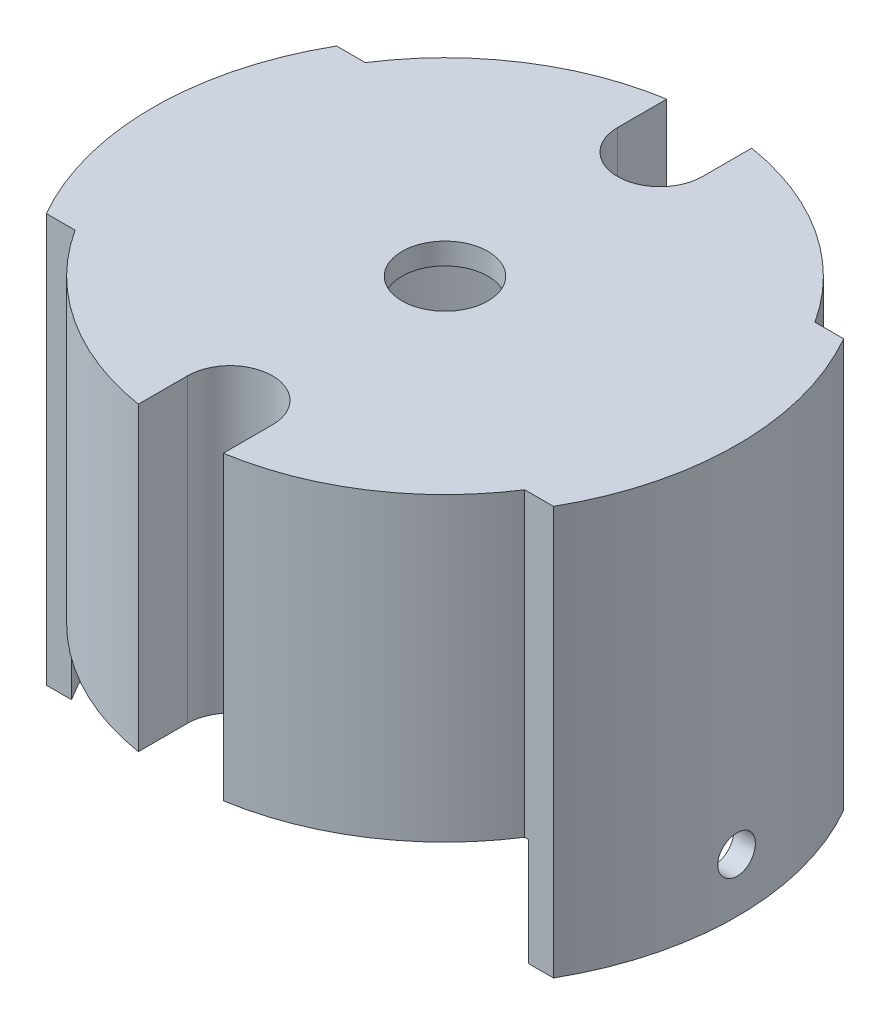
from build123d import *

# Parameters (mm, degrees)
SKETCH2_R               = 27.178
BOSS_EXTRUDE1_DEPTH     = 10
BOSS_EXTRUDE2_START     = -28
BOSS_EXTRUDE2_DEPTH     = 28
SHELL1_START            = -10
SHELL1_DEPTH            = 36
SHELL1_2_DEPTH          = 8
CUT_EXTRUDE3_DEPTH      = 10
CUT_EXTRUDE4_DEPTH      = 47.115916344
CUT_EXTRUDE4_DEPTH_BACK = 47.115916344
SKETCH6_R               = 1.75
SKETCH7_R               = 4
CUT_EXTRUDE6_DEPTH      = 47.115916478


# Read off the part's stored shape, not the designer's step: Shell1
with BuildPart() as part:
    # Sketch2 → Boss-Extrude1 (new body)
    with BuildSketch(Plane(origin=(0, 0, 0), x_dir=(1, 0, 0), z_dir=(0, 1, 0))):
        with Locations(Location((0, 0, 0), (0, 0, 270))):
            Circle(SKETCH2_R)
    extrude(amount=-BOSS_EXTRUDE1_DEPTH)

    # Sketch3 → Boss-Extrude2 (add)
    with BuildSketch(Plane(origin=(0, 0, 0), x_dir=(-1, 0, 0), z_dir=(0, -1, 0)).offset(BOSS_EXTRUDE2_START)):
        with BuildLine():
            Line((-23.587998728, 13.5), (-20.913788663, 13.5))
            ThreePointArc((-20.913788663, 13.5), (-13.609833087, 20.842480649), (-3.95, 24.57710431))
            Line((-3.95, 24.57710431), (-3.95, 20))
            ThreePointArc((-3.95, 20), (0, 16.05), (3.95, 20))
            Line((3.95, 20), (3.95, 24.57710431))
            ThreePointArc((3.95, 24.57710431), (13.609833087, 20.842480649), (20.913788663, 13.5))
            Line((20.913788663, 13.5), (23.587998728, 13.5))
            ThreePointArc((23.587998728, 13.5), (27.178, 0), (23.587998728, -13.5))
            Line((23.587998728, -13.5), (20.913788663, -13.5))
            ThreePointArc((20.913788663, -13.5), (13.609833087, -20.842480649), (3.95, -24.57710431))
            Line((3.95, -24.57710431), (3.95, -20))
            ThreePointArc((3.95, -20), (0, -16.05), (-3.95, -20))
            Line((-3.95, -20), (-3.95, -24.57710431))
            ThreePointArc((-3.95, -24.57710431), (-13.609833087, -20.842480649), (-20.913788663, -13.5))
            Line((-20.913788663, -13.5), (-23.587998728, -13.5))
            ThreePointArc((-23.587998728, -13.5), (-27.178, 0), (-23.587998728, 13.5))
        make_face()
    extrude(amount=BOSS_EXTRUDE2_DEPTH)

    # Shell1 outline → Shell1 (cut)
    with BuildSketch(Plane(origin=(0, 0, 0), x_dir=(1, 0, 0), z_dir=(0, 1, 0)).offset(SHELL1_START)):
        with BuildLine():
            ThreePointArc((22.398251807, -11.5), (25.178, 0), (22.398251807, 11.5))
            Line((22.398251807, 11.5), (19.794356677, 11.5))
            ThreePointArc((19.794356677, 11.5), (13.921689669, 18.172867496), (5.95, 22.105747132))
            Line((5.95, 22.105747132), (5.95, 20))
            ThreePointArc((5.95, 20), (0, 14.05), (-5.95, 20))
            Line((-5.95, 20), (-5.95, 22.105747132))
            ThreePointArc((-5.95, 22.105747132), (-13.921689669, 18.172867496), (-19.794356677, 11.5))
            Line((-19.794356677, 11.5), (-22.398251807, 11.5))
            ThreePointArc((-22.398251807, 11.5), (-25.178, 0), (-22.398251807, -11.5))
            Line((-22.398251807, -11.5), (-19.794356677, -11.5))
            ThreePointArc((-19.794356677, -11.5), (-13.921689669, -18.172867496), (-5.95, -22.105747132))
            Line((-5.95, -22.105747132), (-5.95, -20))
            ThreePointArc((-5.95, -20), (0, -14.05), (5.95, -20))
            Line((5.95, -20), (5.95, -22.105747132))
            ThreePointArc((5.95, -22.105747132), (13.921689669, -18.172867496), (19.794356677, -11.5))
            Line((19.794356677, -11.5), (22.398251807, -11.5))
        make_face()
    extrude(amount=SHELL1_DEPTH, mode=Mode.SUBTRACT)

    # Shell1 2 outline → Shell1 2 (cut)
    with BuildSketch(Plane(origin=(0, 0, 0), x_dir=(1, 0, 0), z_dir=(0, 1, 0)).offset(SHELL1_START)):
        with BuildLine():
            Line((19.794356677, 11.5), (22.398251807, 11.5))
            ThreePointArc((22.398251807, 11.5), (0, 25.178), (-22.398251807, 11.5))
            Line((-22.398251807, 11.5), (-19.794356677, 11.5))
            ThreePointArc((-19.794356677, 11.5), (-13.921689669, 18.172867496), (-5.95, 22.105747132))
            Line((-5.95, 22.105747132), (-5.95, 20))
            ThreePointArc((-5.95, 20), (0, 14.05), (5.95, 20))
            Line((5.95, 20), (5.95, 22.105747132))
            ThreePointArc((5.95, 22.105747132), (13.921689669, 18.172867496), (19.794356677, 11.5))
        make_face()
        with BuildLine():
            ThreePointArc((-22.398251807, -11.5), (0, -25.178), (22.398251807, -11.5))
            Line((22.398251807, -11.5), (19.794356677, -11.5))
            ThreePointArc((19.794356677, -11.5), (13.921689669, -18.172867496), (5.95, -22.105747132))
            Line((5.95, -22.105747132), (5.95, -20))
            ThreePointArc((5.95, -20), (0, -14.05), (-5.95, -20))
            Line((-5.95, -20), (-5.95, -22.105747132))
            ThreePointArc((-5.95, -22.105747132), (-13.921689669, -18.172867496), (-19.794356677, -11.5))
            Line((-19.794356677, -11.5), (-22.398251807, -11.5))
        make_face()
    extrude(amount=SHELL1_2_DEPTH, mode=Mode.SUBTRACT)

    # Sketch5 → Cut-Extrude3 (cut)
    with BuildSketch(Plane(origin=(0, -10, 0), x_dir=(1, 0, 0), z_dir=(0, 1, 0))):
        with BuildLine():
            Line((-23.587998728, 13.5), (-21.252804144, 13.5))
            ThreePointArc((-21.252804144, 13.5), (-21.848424918, 12.513113625), (-22.398251807, 11.5))
            Line((-22.398251807, 11.5), (22.398251807, 11.5))
            ThreePointArc((22.398251807, 11.5), (21.848424918, 12.513113625), (21.252804144, 13.5))
            Line((21.252804144, 13.5), (23.587998728, 13.5))
            ThreePointArc((23.587998728, 13.5), (0, 27.178), (-23.587998728, 13.5))
        make_face()
    cut_extrude3 = extrude(amount=CUT_EXTRUDE3_DEPTH, mode=Mode.SUBTRACT)

    # Mirror1: Cut-Extrude3 across plane
    add(cut_extrude3.mirror(Plane.XY), mode=Mode.SUBTRACT)

    # Sketch6 → Cut-Extrude4 (cut, two sides: drawn at the far end of the back side and taken through both)
    with BuildSketch(Plane(origin=(0, 0, 0), x_dir=(0, 0, -1), z_dir=(1, 0, 0)).offset(-CUT_EXTRUDE4_DEPTH_BACK)):
        with Locations((0, -5)):
            Circle(SKETCH6_R)
    extrude(amount=CUT_EXTRUDE4_DEPTH + CUT_EXTRUDE4_DEPTH_BACK, mode=Mode.SUBTRACT)

    # Sketch7 → Cut-Extrude6 (cut, through all)
    with BuildSketch(Plane(origin=(0, 0, 0), x_dir=(1, 0, 0), z_dir=(0, 1, 0))):
        with Locations(Location((0, 0, 0), (0, 0, 90))):
            Circle(SKETCH7_R)
    extrude(amount=CUT_EXTRUDE6_DEPTH, mode=Mode.SUBTRACT)


solid = part.part
